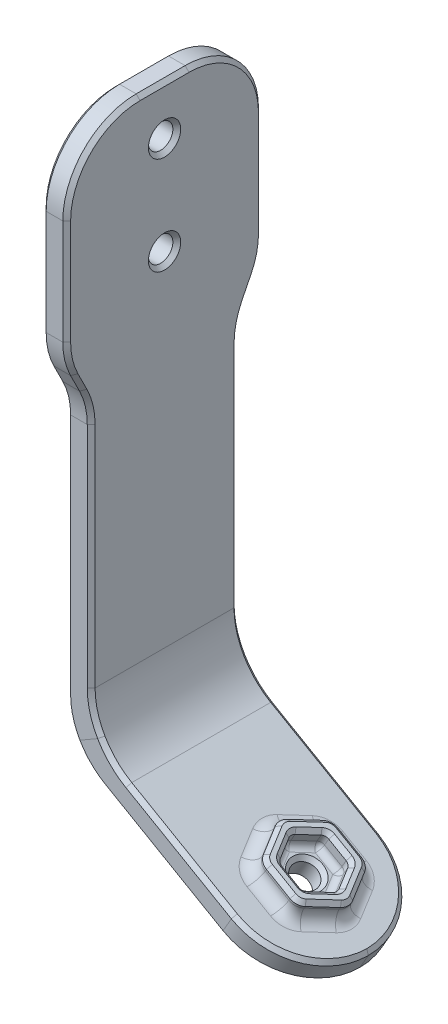
from build123d import *

# Parameters (mm, degrees)
SKETCH2_W           = 3.175
SKETCH2_H           = 19.05
BOSS_EXTRUDE1_DEPTH = 3.175
CUT_EXTRUDE1_REACH  = 95.125
SKETCH3_R           = 1.5875
CUT_EXTRUDE2_REACH  = 80.237
SKETCH5_R           = 1.5875
BOSS_EXTRUDE2_DEPTH = 2.38125
FILLET1_R           = 9.525
FILLET2_R           = 9.525
FILLET3_R           = 9.525
FILLET4_R           = 1.5875
FILLET5_R           = 0.79375
CHAMFER1_SIZE       = 0.508


with BuildPart() as part:
    # Sweep1: sweep along a path in Sketch1
    with BuildLine(Plane.XY) as sweep1_path:
        Line((0, 0), (0, -31.75))
        Line((0, -31.75), (0, -70.0334134))
        Line((0, -70.0334134), (27.49630657, -85.9084134))
    # Sketch2 → Sweep1 (sweep)
    with BuildSketch(Plane(origin=(0, 0, 0), x_dir=(1, 0, 0), z_dir=(0, 1, 0))):
        Rectangle(SKETCH2_W, SKETCH2_H)
    sweep(path=sweep1_path.line, transition=Transition.RIGHT)

    # Sketch4 → Boss-Extrude1 (add)
    with BuildSketch(Plane.ZY.offset(1.5875)):
        Polygon((-12.7, -25.4), (-9.525, -31.75), (9.525, -31.75), (12.7, -25.4), (12.7, 0), (-12.7, 0), align=None)
    extrude(amount=-BOSS_EXTRUDE1_DEPTH)

    # Sketch3 → Cut-Extrude1 (cut, up to next)
    with BuildSketch(Plane.ZY.offset(1.5875), mode=Mode.PRIVATE) as cut_extrude1_sk1:
        with Locations(Location((0, -6.35, 0), (0, 0, 270))):
            Circle(SKETCH3_R)
    cut_extrude1_tool1 = extrude(cut_extrude1_sk1.sketch, amount=-CUT_EXTRUDE1_REACH, mode=Mode.PRIVATE) & part.part
    # Sketch3 → Cut-Extrude1 (cut, up to next)
    with BuildSketch(Plane.ZY.offset(1.5875), mode=Mode.PRIVATE) as cut_extrude1_sk2:
        with Locations(Location((0, -19.05, 0), (0, 0, 270))):
            Circle(SKETCH3_R)
    cut_extrude1_tool2 = extrude(cut_extrude1_sk2.sketch, amount=-CUT_EXTRUDE1_REACH, mode=Mode.PRIVATE) & part.part
    add(cut_extrude1_tool1.solids().sort_by_distance((-1.5875, -6.35, 0))[0], mode=Mode.SUBTRACT)
    add(cut_extrude1_tool2.solids().sort_by_distance((-1.5875, -19.05, 0))[0], mode=Mode.SUBTRACT)

    # Sketch5 → Cut-Extrude2 (cut, up to next)
    with BuildSketch(Plane(origin=(-29.531607559, -51.150244721, 0), x_dir=(0.86602540378444, -0.4999999999999976, 0), z_dir=(0.4999999999999977, 0.8660254037844402, 0)), mode=Mode.PRIVATE) as cut_extrude2_sk1:
        with Locations(Location((57.2417067, 0, 0), (0, 0, 180))):
            Circle(SKETCH5_R)
    cut_extrude2_tool1 = extrude(cut_extrude2_sk1.sketch, amount=-CUT_EXTRUDE2_REACH, mode=Mode.PRIVATE) & part.part
    add(cut_extrude2_tool1.solids().sort_by_distance((20.041165, -79.771098, 0))[0], mode=Mode.SUBTRACT)

    # Sketch6 → Boss-Extrude2 (add)
    with BuildSketch(Plane(origin=(-29.531607559, -51.150244721, 0), x_dir=(0.86602540378444, -0.4999999999999976, 0), z_dir=(0.4999999999999977, 0.8660254037844402, 0))):
        Polygon((59.918013873, 4.6355), (54.565399527, 4.6355), (51.889092354, 0), (54.565399527, -4.6355), (59.918013873, -4.6355), (62.594321046, 0), align=None)
        Polygon((59.00147032, 3.048), (55.48194308, 3.048), (53.722179459, 0), (55.48194308, -3.048), (59.00147032, -3.048), (60.761233941, 0), align=None, mode=Mode.SUBTRACT)
    extrude(amount=BOSS_EXTRUDE2_DEPTH)

    # Fillet1
    fillet1_edges = [part.edges().sort_by_distance(p)[0] for p in [
        (27.49630657, -85.9084134, -9.525),
        (27.49630657, -85.9084134, 9.525),
    ]]
    fillet(fillet1_edges, radius=FILLET1_R - 0.0001)  # a hair under: the kernel refuses the full size

    # Fillet2
    fillet2_edges = [part.edges().sort_by_distance(p)[0] for p in [
        (1.5875, -69.116869848, 0),
        (-1.5875, -70.949956952, 0),
    ]]
    fillet(fillet2_edges, radius=FILLET2_R)

    # Fillet3
    fillet3_edges = [part.edges().sort_by_distance(p)[0] for p in [
        (0, 0, -12.7),
        (0, -25.4, -12.7),
        (0, 0, 12.7),
        (0, -25.4, 12.7),
        (0, -31.75, -9.525),
        (0, -31.75, 9.525),
    ]]
    fillet(fillet3_edges, radius=FILLET3_R)

    # Fillet4
    fillet4_edges = [part.edges().sort_by_distance(p)[0] for p in [
        (23.517789599, -81.778328451, -2.31775),
        (25.271977099, -81.416293748, 0),
        (20.041164599, -79.771098071, -4.6355),
        (22.954227099, -80.078140162, -4.6355),
        (16.564539599, -77.763867692, -2.31775),
        (18.318727099, -77.401832989, -4.6355),
        (16.564539599, -77.763867692, 2.31775),
        (16.000977099, -76.063679402, 0),
        (20.041164599, -79.771098071, 4.6355),
        (18.318727099, -77.401832989, 4.6355),
        (23.517789599, -81.778328451, 2.31775),
        (22.954227099, -80.078140162, 4.6355),
    ]]
    fillet(fillet4_edges, radius=FILLET4_R)

    # Fillet5
    fillet5_edges = [part.edges().sort_by_distance(p)[0] for p in [
        (22.327164599, -81.090920787, -1.524),
        (20.041164599, -79.771098071, -3.048),
        (17.755164599, -78.451275356, -1.524),
        (17.755164599, -78.451275356, 1.524),
        (20.041164599, -79.771098071, 3.048),
        (22.327164599, -81.090920787, 1.524),
        (22.160477099, -79.619868385, -3.048),
        (19.112477099, -77.860104765, -3.048),
        (17.588477099, -76.980222955, 0),
        (19.112477099, -77.860104765, 3.048),
        (22.160477099, -79.619868385, 3.048),
        (23.684477099, -80.499750196, 0),
    ]]
    fillet(fillet5_edges, radius=FILLET5_R)

    # Chamfer1
    chamfer1_edges = [part.edges().sort_by_distance(p)[0] for p in [
        (24.286537414, -85.888339419, 6.73522138),
        (24.286537414, -85.888339419, -6.73522138),
        (25.874037414, -83.138708762, 6.73522138),
        (25.874037414, -83.138708762, -6.73522138),
        (10.814375601, -78.110183169, -9.525),
        (10.814375601, -78.110183169, 9.525),
        (13.195625601, -75.818824288, -9.525),
        (-0.311391971, -70.213195638, -9.525),
        (-0.311391971, -70.213195638, -9.525),
        (-0.311391971, -70.213195638, 9.525),
        (13.195625601, -75.818824288, 9.525),
        (-0.311391971, -70.213195638, 9.525),
        (2.863608029, -68.380108534, 9.525),
        (2.863608029, -68.380108534, 9.525),
        (2.863608029, -68.380108534, -9.525),
        (2.863608029, -68.380108534, -9.525),
        (1.5875, 0, 0),
        (-1.5875, 0, 0),
        (-1.5875, -49.724621562, -9.525),
        (-1.5875, -49.724621562, 9.525),
        (-1.5875, -28.575, 11.1125),
        (-1.5875, -16.338226257, 12.7),
        (-1.5875, -16.338226257, -12.7),
        (-1.5875, -28.575, -11.1125),
        (-1.5875, -25.339849083, 12.445196625),
        (-1.5875, -25.339849083, -12.445196625),
        (-1.5875, -2.789807909, 9.910192091),
        (-1.5875, -2.789807909, -9.910192091),
        (1.5875, -16.338226257, -12.7),
        (1.5875, -48.80807801, 9.525),
        (1.5875, -48.80807801, -9.525),
        (1.5875, -28.575, -11.1125),
        (1.5875, -16.338226257, 12.7),
        (1.5875, -28.575, 11.1125),
        (1.5875, -25.339849083, 12.445196625),
        (1.5875, -25.339849083, -12.445196625),
        (1.5875, -2.789807909, 9.910192091),
        (1.5875, -2.789807909, -9.910192091),
        (-1.5875, -31.810150917, -9.779803375),
        (1.5875, -31.810150917, -9.779803375),
        (1.5875, -31.810150917, 9.779803375),
        (-1.5875, -31.810150917, 9.779803375),
        (24.708414599, -79.716105458, -2.31775),
        (24.708414599, -79.716105458, 2.31775),
        (21.231789599, -77.708875079, -4.6355),
        (17.755164599, -75.701644699, -2.31775),
        (17.755164599, -75.701644699, 2.31775),
        (21.231789599, -77.708875079, 4.6355),
        (23.443197263, -78.985631889, 4.422815329),
        (19.020381935, -76.432118268, 4.422815329),
        (23.443197263, -78.985631889, -4.422815329),
        (19.020381935, -76.432118268, -4.422815329),
        (16.808974271, -75.155361458, 0),
        (25.654604928, -80.262388699, 0),
        (21.231789599, -77.708875079, 3.048),
        (18.945789599, -76.389052363, 1.524),
        (21.231789599, -77.708875079, -3.048),
        (23.517789599, -79.028697794, -1.524),
        (23.517789599, -79.028697794, 1.524),
        (18.945789599, -76.389052363, -1.524),
        (18.290131935, -76.010508234, 0),
        (19.760960767, -76.859691657, 2.941657664),
        (22.702618431, -78.558058501, 2.941657664),
        (24.173447263, -79.407241923, 0),
        (22.702618431, -78.558058501, -2.941657664),
        (19.760960767, -76.859691657, -2.941657664),
        (-1.5875, -4.7625, 0),
        (1.5875, -4.7625, 0),
        (-1.5875, -17.4625, 0),
        (1.5875, -17.4625, 0),
        (21.415979928, -80.564848071, 0),
        (19.828479928, -83.314478729, 0),
    ]]
    chamfer(chamfer1_edges, length=CHAMFER1_SIZE)


solid = part.part
